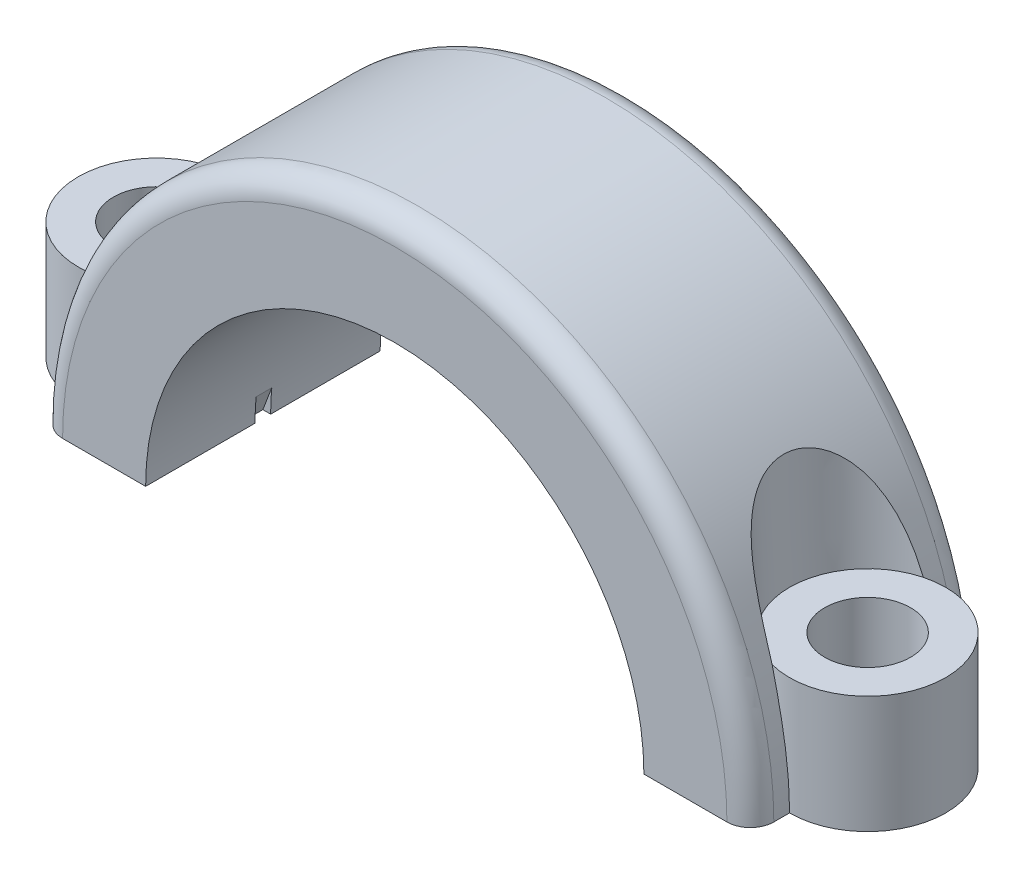
from build123d import *

# Parameters (mm, degrees)
BOSS_EXTRUDE1_DEPTH     = 15
SKETCH2_R               = 10
BOSS_EXTRUDE2_DEPTH     = 15
CUT_EXTRUDE1_START      = -15
SKETCH2_2_R             = 10
CUT_EXTRUDE1_DEPTH      = 45
CUT_EXTRUDE1_DRAFT      = 3
M10_CLEARANCE_HOLE1_D   = 11
MIRROR1_START           = -15
MIRROR1_COPY_1_SKETCH_R = 10
MIRROR1_COPY_1_DEPTH    = 45
MIRROR1_COPY_1_DRAFT    = 3
FILLET1_R               = 3
SKETCH5_W               = 1
SKETCH5_H               = 2


with BuildPart() as part:
    # Sketch1 → Boss-Extrude1 (new, symmetric)
    with BuildSketch(Plane.XY):
        with BuildLine():
            Line((-45.5, 0), (-31.875, 0))
            ThreePointArc((-31.875, 0), (0, 31.875), (31.875, 0))
            Line((31.875, 0), (45.5, 0))
            ThreePointArc((45.5, 0), (0, 45.5), (-45.5, 0))
        make_face()
    extrude(amount=BOSS_EXTRUDE1_DEPTH, both=True)

    # Sketch2 → Boss-Extrude2 (add)
    with BuildSketch(Plane.XZ):
        with Locations((-45.5, 0)):
            Circle(SKETCH2_R)
    boss_extrude2 = extrude(amount=-BOSS_EXTRUDE2_DEPTH)


with BuildPart() as cut_extrude1_tool:
    # Sketch2<2> → Cut-Extrude1 (with draft: the straight prism first)
    with BuildSketch(Plane.XZ.offset(CUT_EXTRUDE1_START)):
        with Locations((-45.5, 0)):
            Circle(SKETCH2_2_R)
    extrude(amount=-CUT_EXTRUDE1_DEPTH)
    # Cut-Extrude1: the draft: its side faces are tilted about the plane it starts from
    cut_extrude1_sides = [cut_extrude1_tool.faces().sort_by_distance(p)[0] for p in [
        (-55.5, 37.5, 0),
    ]]
    draft(cut_extrude1_sides, Plane.XZ.offset(CUT_EXTRUDE1_START), CUT_EXTRUDE1_DRAFT)


with BuildPart() as part_1:
    add(part.part)

    # Cut-Extrude1: cut by cut_extrude1_tool
    add(cut_extrude1_tool.part, mode=Mode.SUBTRACT)

    # M10 Clearance Hole1 (through all)
    with Locations(Plane(origin=(0, 15, 0), x_dir=(1, 0, 0), z_dir=(0, 1, 0))):
        with Locations((-45.5, 0)):
            m10_clearance_hole1 = Hole(M10_CLEARANCE_HOLE1_D / 2)

    # Mirror1: Boss-Extrude2, M10 Clearance Hole1 across plane
    add(boss_extrude2.mirror(Plane(origin=(0, 0, 0), x_dir=(0, 0, 1), z_dir=(1, 0, 0))))
    add(m10_clearance_hole1.mirror(Plane(origin=(0, 0, 0), x_dir=(0, 0, 1), z_dir=(1, 0, 0))), mode=Mode.SUBTRACT)


with BuildPart() as mirror1_copy_1_tool:
    # Mirror1 copy 1 sketch → Mirror1 copy 1 (with draft: the straight prism first)
    with BuildSketch(Plane(origin=(0, 0, 0), x_dir=(-1, 0, 0), z_dir=(0, -1, 0)).offset(MIRROR1_START)):
        with Locations((-45.5, 0)):
            Circle(MIRROR1_COPY_1_SKETCH_R)
    extrude(amount=-MIRROR1_COPY_1_DEPTH)
    # Mirror1 copy 1: the draft: its side faces are tilted about the plane it starts from
    mirror1_copy_1_sides = [mirror1_copy_1_tool.faces().sort_by_distance(p)[0] for p in [
        (55.5, 37.5, 0),
    ]]
    draft(mirror1_copy_1_sides, Plane(origin=(0, 0, 0), x_dir=(-1, 0, 0), z_dir=(0, -1, 0)).offset(MIRROR1_START), MIRROR1_COPY_1_DRAFT)


with BuildPart() as part_2:
    add(part_1.part)

    # Mirror1 copy 1: cut by mirror1_copy_1_tool
    add(mirror1_copy_1_tool.part, mode=Mode.SUBTRACT)

    # Fillet1
    fillet1_edges = [part_2.edges().sort_by_distance(p)[0] for p in [
        (0, 45.5, 15),
        (0, 45.5, -15),
    ]]
    fillet(fillet1_edges, radius=FILLET1_R)

    # Cut-Sweep1: sweep along a path in Sketch6
    with BuildLine(Plane.XY) as cut_sweep1_path:
        Line((-32.875, 0), (-31.733509497, 3))
    # Sketch5 → Cut-Sweep1 (sweep, cut)
    with BuildSketch(Plane(origin=(0, 0, 10), x_dir=(1, 0, 0), z_dir=(0, 1, 0))):
        with Locations((-32.375, 10)):
            Rectangle(SKETCH5_W, SKETCH5_H)
    sweep(path=cut_sweep1_path.line, mode=Mode.SUBTRACT)


solid = part_2.part
